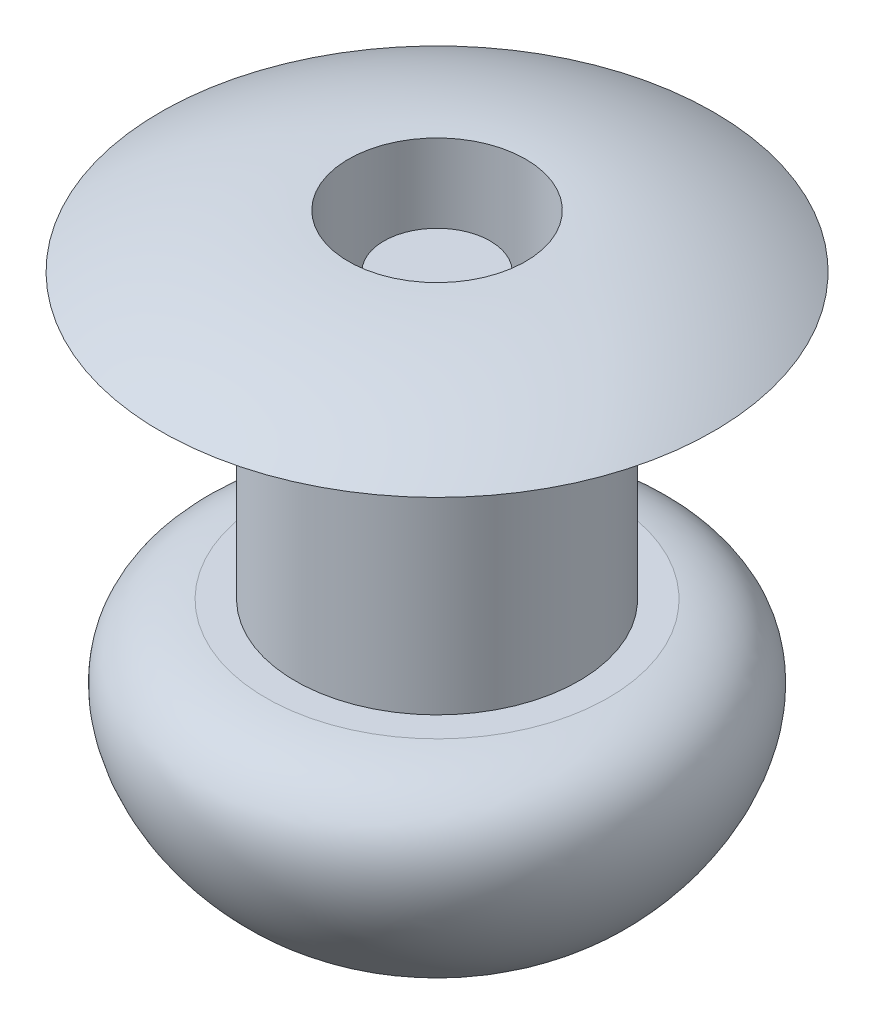
from build123d import *


with BuildPart() as part:
    # Szkic1 → Obrót1 (revolve)
    with BuildSketch(Plane(origin=(0, 0, 0), x_dir=(0, 0, -1), z_dir=(1, 0, 0))):
        with BuildLine():
            Line((0, 0), (0, -4.121746268))
            Line((0, -4.121746268), (0, -4.200738523))
            Line((0, -4.200738523), (0, -5.700738523))
            add(Edge.make_bspline(
                [(-0.956030427, -5.578929194), (-0.520263876, -5.700738523), (0, -5.700738523)],
                knots=[0.992852221, 0.992852221, 0.992852221, 1.570796327, 1.570796327, 1.570796327], degree=2, weights=[1, 0.958537313, 1]))
            add(Edge.make_bspline(
                [(-2.413891755, -4), (-3.867503112, -4.169657322), (-3.528877649, -6.302013626), (-1.083961642, -7.873532369), (-0.271752618, -5.874949298), (-0.956030427, -5.578929194)],
                knots=[0, 0, 0, 0, 0.464993082, 0.721927553, 1, 1, 1, 1], degree=3))
            Line((-2.413891755, -4), (-2, -4))
            Line((-2, -4), (-2, 0))
            Line((-2, 0), (-3.9, 0))
            ThreePointArc((-3.9, 0), (-2.627043935, 0.558888572), (-1.25, 0.75))
            Line((-1.25, 0.75), (-1.25, -4.200738523))
            Line((-1.25, -4.200738523), (-0.75, -4.200738523))
            Line((-0.75, -4.200738523), (-0.75, 0))
            Line((-0.75, 0), (0, 0))
        make_face()
    revolve(axis=Axis((0, 0, 0), (0, 1, 0)))


solid = part.part
